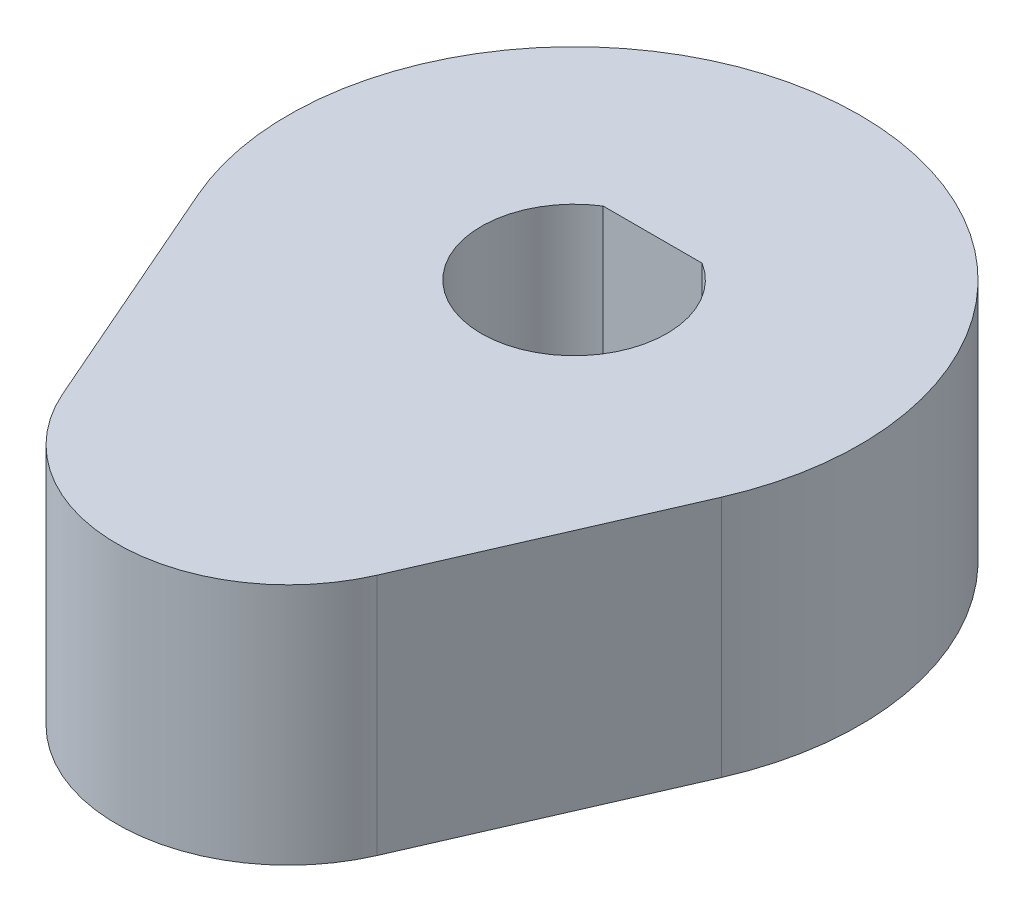
from build123d import *

# Parameters (mm, degrees)
BOSS_EXTRUDE1_DEPTH = 8.5


with BuildPart() as part:
    # Sketch1 → Boss-Extrude1 (new body)
    with BuildSketch(Plane(origin=(0, 0, 0), x_dir=(1, 0, 0), z_dir=(0, 1, 0))):
        with BuildLine():
            Line((-9.16515139, -4), (-5.499090834, -12.4))
            ThreePointArc((-5.499090834, -12.4), (0, -16), (5.499090834, -12.4))
            Line((5.499090834, -12.4), (9.16515139, -4))
            ThreePointArc((9.16515139, -4), (0, 10), (-9.16515139, -4))
        make_face()
        with BuildLine():
            Line((1.732039549, 2.75), (-1.732039549, 2.75))
            ThreePointArc((-1.732039549, 2.75), (0, -3.249994), (1.732039549, 2.75))
        make_face(mode=Mode.SUBTRACT)
    extrude(amount=BOSS_EXTRUDE1_DEPTH)


solid = part.part
